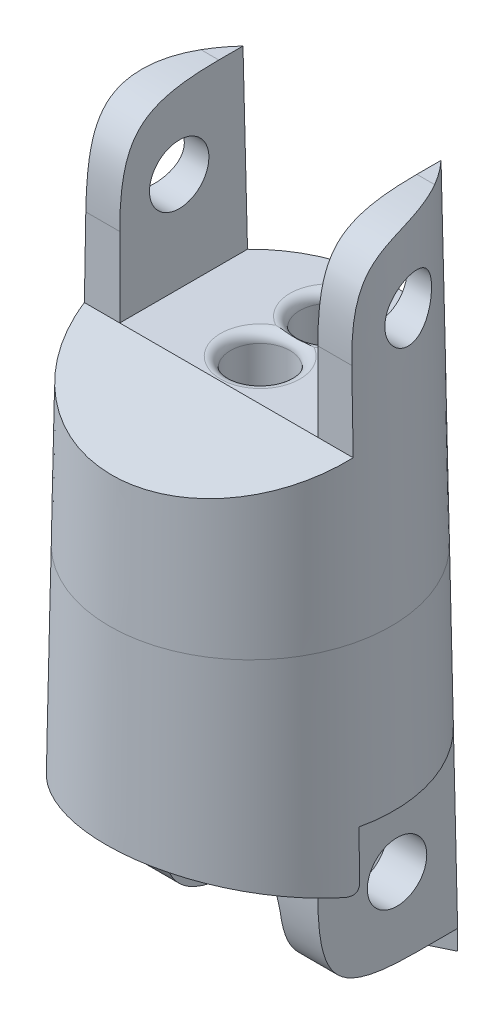
from build123d import *

# Parameters (mm, degrees)
SKETCH1_R                     = 7.25
BOSS_EXTRUDE1_DEPTH           = 25
BOSS_EXTRUDE1_TAPER           = 1.0000000000000022
BOSS_EXTRUDE1_OTHER_WAY_DEPTH = 9
BOSS_EXTRUDE1_OTHER_WAY_TAPER = -1.0000000000000022
CUT_EXTRUDE1_DEPTH            = 28.105905813890665
CUT_EXTRUDE1_DEPTH_BACK       = 28.105905813890665
CUT_EXTRUDE2_START            = -9.0000001
CUT_EXTRUDE2_OUTLINE_W        = 6.011422006
CUT_EXTRUDE2_OUTLINE_H        = 9
CUT_EXTRUDE2_DEPTH            = 9.0000001
CUT_EXTRUDE3_DEPTH            = 29.808463581509777
CUT_EXTRUDE3_DEPTH_BACK       = 29.808463581509777
SKETCH4_R                     = 1.5000000000000007
FILLET1_SIZE                  = 5
CUT_EXTRUDE4_DEPTH            = 28.063399138452198
CUT_EXTRUDE4_DEPTH_BACK       = 28.063399138452198
CUT_EXTRUDE5_DEPTH            = 28.542013511179608
CUT_EXTRUDE6_DEPTH            = 29.808463581509773
CUT_EXTRUDE6_DEPTH_BACK       = 29.808463581509773
SKETCH7_R                     = 1.5000000000000004
FILLET2_SIZE                  = 5
CUT_EXTRUDE7_DEPTH            = 9
BOSS_EXTRUDE2_START           = 1
BOSS_EXTRUDE2_DEPTH           = 1
SKETCH11_R                    = 1.5000000000000004
SKETCH11_R_2                  = 1.5000000000000002
CUT_EXTRUDE8_DEPTH            = 16
FILLET4_R                     = 0.5


with BuildPart() as part:
    # Sketch1 → Boss-Extrude1 (new body)
    with BuildSketch(Plane(origin=(0, 0, 0), x_dir=(1, 0, 0), z_dir=(0, 1, 0))):
        Circle(SKETCH1_R)
    extrude(amount=BOSS_EXTRUDE1_DEPTH, taper=BOSS_EXTRUDE1_TAPER)

    # Sketch1 → Boss-Extrude1 other way (add)
    with BuildSketch(Plane(origin=(0, 0, 0), x_dir=(1, 0, 0), z_dir=(0, 1, 0))):
        Circle(SKETCH1_R)
    extrude(amount=-BOSS_EXTRUDE1_OTHER_WAY_DEPTH, taper=BOSS_EXTRUDE1_OTHER_WAY_TAPER)

    # Sketch2 → Cut-Extrude1 (cut, two sides: drawn at the far end of the back side and taken through both)
    with BuildSketch(Plane(origin=(0, 0, 0), x_dir=(0, 0, -1), z_dir=(1, 0, 0)).offset(-CUT_EXTRUDE1_DEPTH_BACK)):
        Polygon((-1.5929044156460401, -9), (-1.5929044156460401, -2.999999999999999), (-14.33710947936327, 0.41479945499961435), (-14.337109479363269, -9), align=None)
    extrude(amount=CUT_EXTRUDE1_DEPTH + CUT_EXTRUDE1_DEPTH_BACK, mode=Mode.SUBTRACT)

    # Cut-Extrude2: read off the stored shape, not the designer's step
    # Cut-Extrude2 outline → Cut-Extrude2 (cut)
    with BuildSketch(Plane.XY.offset(1.5929044156460401).offset(CUT_EXTRUDE2_START)):
        with Locations((8.005711003, -4.5)):
            Rectangle(CUT_EXTRUDE2_OUTLINE_W, CUT_EXTRUDE2_OUTLINE_H)
        with Locations((-8.005711003, -4.5)):
            Rectangle(CUT_EXTRUDE2_OUTLINE_W, CUT_EXTRUDE2_OUTLINE_H)
    extrude(amount=CUT_EXTRUDE2_DEPTH, mode=Mode.SUBTRACT)

    # Sketch4 → Cut-Extrude3 (cut, two sides: drawn at the far end of the back side and taken through both)
    with BuildSketch(Plane(origin=(5.000000000000001, 4.8e-16, 0), x_dir=(0, 0, -1), z_dir=(1, 1e-16, 0)).offset(-CUT_EXTRUDE3_DEPTH_BACK)):
        with Locations(Location((2.40709558435396, -4.999999999999999, 0), (0, 0, 270))):
            Circle(SKETCH4_R)
    extrude(amount=CUT_EXTRUDE3_DEPTH + CUT_EXTRUDE3_DEPTH_BACK, mode=Mode.SUBTRACT)

    # Fillet1
    # a fillet whose section is not a circle: 5 mm, written as the material it takes off along each edge
    with BuildSketch(Plane(origin=(17.5, -9, 1.5929044156460401), x_dir=(0, 0, -1), z_dir=(-1, 0, 0))) as fillet1_piece_1:
        with BuildLine():
            Bezier((FILLET1_SIZE, 0), (0, 0), (0, -FILLET1_SIZE), weights=[1, 1.4999999999999998, 1])
            Line((0, -FILLET1_SIZE), (0, 0))
            Line((0, 0), (FILLET1_SIZE, 0))
        make_face()
    extrude(amount=35, mode=Mode.SUBTRACT)

    # Sketch5 → Cut-Extrude4 (cut, two sides: drawn at the far end of the back side and taken through both)
    with BuildSketch(Plane(origin=(0, 0, 0), x_dir=(0, 0, -1), z_dir=(1, 0, 0)).offset(-CUT_EXTRUDE4_DEPTH_BACK)):
        Polygon((-1.5929044156460401, 25), (-1.592904415646039, 16), (-13.213514486890537, 12.886266915853101), (-13.213514486890539, 25), align=None)
    extrude(amount=CUT_EXTRUDE4_DEPTH + CUT_EXTRUDE4_DEPTH_BACK, mode=Mode.SUBTRACT)

    # Sketch6 → Cut-Extrude5 (cut, through all)
    with BuildSketch(Plane.XY.offset(1.5929044156460372)):
        Polygon((4.999999999999998, 25), (-5.000000000000002, 25), (-4.999999999999999, 16), (4.999999999999999, 16), align=None)
    extrude(amount=-CUT_EXTRUDE5_DEPTH, mode=Mode.SUBTRACT)

    # Sketch7 → Cut-Extrude6 (cut, two sides: drawn at the far end of the back side and taken through both)
    with BuildSketch(Plane(origin=(-4.999999999999995, -1.45e-15, 0), x_dir=(0, 0, -1), z_dir=(1, 2.9e-16, 0)).offset(-CUT_EXTRUDE6_DEPTH_BACK)):
        with Locations(Location((1.407095584353963, 21, 0), (0, 0, 90))):
            Circle(SKETCH7_R)
    extrude(amount=CUT_EXTRUDE6_DEPTH + CUT_EXTRUDE6_DEPTH_BACK, mode=Mode.SUBTRACT)

    # Fillet2
    # a fillet whose section is not a circle: 5 mm, written as the material it takes off along each edge
    with BuildSketch(Plane(origin=(-7.5, 25, 1.5929044156460401), x_dir=(0, -1, -1.3e-16), z_dir=(1, 0, 0))) as fillet2_piece_1:
        with BuildLine():
            Bezier((FILLET2_SIZE, 0), (0, 0), (6.7e-16, FILLET2_SIZE), weights=[1, 1.4999999999999998, 1])
            Line((6.7e-16, FILLET2_SIZE), (0, 0))
            Line((0, 0), (FILLET2_SIZE, 0))
        make_face()
    extrude(amount=26.62481086850157, mode=Mode.SUBTRACT)
    with BuildSketch(Plane(origin=(-19.124810868501584, 25, 1.5929044156460401), x_dir=(0, 0, -1), z_dir=(1, 0, 0))) as fillet2_piece_2:
        with BuildLine():
            Bezier((FILLET2_SIZE, 0), (8.9e-16, 0), (6.7e-16, -FILLET2_SIZE), weights=[1, 1.4999999999999998, 1])
            Line((6.7e-16, -FILLET2_SIZE), (0, 0))
            Line((0, 0), (FILLET2_SIZE, 0))
        make_face()
    extrude(amount=26.624810868501584, mode=Mode.SUBTRACT)

    # Fillet3
    # a fillet whose section is not a circle: 0.5 mm, written as the material it takes off along each edge
    with BuildSketch(Plane(origin=(-8.755545096423258, -2.999999999999999, 1.5929044156460401), x_dir=(0, 0.2588190451025175, 0.9659258262890692), z_dir=(1, 0, 0))) as fillet3_piece_1:
        with BuildLine():
            Bezier((0.6516126864206009, 0), (0, 0), (0.16864977327606598, -0.6294095225512586), weights=[1, 1, 1])
            Line((0.16864977327606598, -0.6294095225512586), (0, 0))
            Line((0, 0), (0.6516126864206009, 0))
        make_face()
    extrude(amount=3.7555450964232584, mode=Mode.SUBTRACT)
    with BuildSketch(Plane(origin=(5, -2.999999999999999, 1.5929044156460401), x_dir=(0, 1, 0), z_dir=(1, 0, 0))) as fillet3_piece_2:
        with BuildLine():
            Bezier((0.6516126864206004, 0), (0, 0), (0.16864977327606612, 0.629409522551259), weights=[1, 1, 1])
            Line((0.16864977327606612, 0.629409522551259), (0, 0))
            Line((0, 0), (0.6516126864206004, 0))
        make_face()
    extrude(amount=3.7555450964232335, mode=Mode.SUBTRACT)

    # Sketch9 → Cut-Extrude7 (cut)
    with BuildSketch(Plane.XZ.offset(9)):
        with BuildLine():
            Line((-2.999999999999999, -4.498520052010449), (-2.999999999999999, 1.4985200520104496))
            ThreePointArc((-2.999999999999999, 1.4985200520104496), (3.3e-16, 2.40709558435396), (3.000000000000001, 1.4985200520104478))
            Line((3.000000000000001, 1.4985200520104478), (3.000000000000001, -4.4985200520104485))
            ThreePointArc((3.000000000000001, -4.4985200520104485), (3.3e-16, -5.40709558435396), (-2.999999999999999, -4.498520052010449))
        make_face()
    extrude(amount=-CUT_EXTRUDE7_DEPTH, mode=Mode.SUBTRACT)

    # Sketch10 → Boss-Extrude2 (add)
    with BuildSketch(Plane.XZ.offset(9).offset(BOSS_EXTRUDE2_START)):
        with BuildLine():
            Line((-2.999999999999999, -4.498520052010449), (-5, -5.464893868663502))
            ThreePointArc((-5, -5.464893868663502), (4.5e-16, -7.407095584353961), (5.000000000000001, -5.4648938686635))
            Line((5.000000000000001, -5.4648938686635), (2.999999999999999, -4.498520052010449))
            ThreePointArc((2.999999999999999, -4.498520052010449), (3.3e-16, -5.40709558435396), (-2.999999999999999, -4.498520052010449))
        make_face()
    extrude(amount=-BOSS_EXTRUDE2_DEPTH)

    # Sketch11 → Cut-Extrude8 (cut)
    with BuildSketch(Plane(origin=(0, 16, 0), x_dir=(1, 0, 0), z_dir=(0, 1, 0))):
        with Locations(Location((0, 4, 0), (0, 0, 270))):
            Circle(SKETCH11_R)
        with Locations(Location((0, 0.5, 0), (0, 0, 270))):
            Circle(SKETCH11_R_2)
    extrude(amount=-CUT_EXTRUDE8_DEPTH, mode=Mode.SUBTRACT)

    # Fillet4
    # the kernel refuses this fillet: 0.5 mm, written as the material it takes off along each edge
    with BuildSketch(Plane(origin=(0, 16, -4), x_dir=(-1.8e-16, 0, 1), z_dir=(-1, 0, -1.8e-16))) as fillet4_piece_1:
        with BuildLine():
            CenterArc((1.5 + FILLET4_R, -FILLET4_R), FILLET4_R, 90, 90)
            Line((1.5, -FILLET4_R), (1.5, 0))
            Line((1.5, 0), (1.5 + FILLET4_R, 0))
        make_face()
    revolve(axis=Axis((0, 16, -4), (0, 1, 0)), mode=Mode.SUBTRACT)
    with BuildSketch(Plane(origin=(0, 0, -4), x_dir=(-1.8e-16, 0, 1), z_dir=(-1, 0, -1.8e-16))) as fillet4_piece_2_section:
        with BuildLine():
            CenterArc((1.5000000000000009 + FILLET4_R, FILLET4_R), FILLET4_R, 180, 90)
            Line((1.5000000000000009 + FILLET4_R, 0), (1.5000000000000009, 0))
            Line((1.5000000000000009, 0), (1.5000000000000009, FILLET4_R))
        make_face()
    fillet4_piece_2 = revolve(axis=Axis((0, 0, -4), (0, 1, 0)), revolution_arc=204.08928885660288, mode=Mode.PRIVATE)
    fillet4_piece_2 = fillet4_piece_2 & Plane(origin=(0, 0, 3.55e-15), x_dir=(0.554826515122247, 0, -0.83196606788817), z_dir=(0, -1, 0)) * Cylinder(5.407095584353963, 9, mode=Mode.PRIVATE)
    add(fillet4_piece_2, mode=Mode.SUBTRACT)
    with BuildSketch(Plane(origin=(0, 16, -0.5), x_dir=(-1.8e-16, 0, 1), z_dir=(-1, 0, -1.8e-16))) as fillet4_piece_3:
        with BuildLine():
            CenterArc((1.5 + FILLET4_R, -FILLET4_R), FILLET4_R, 90, 90)
            Line((1.5, -FILLET4_R), (1.5, 0))
            Line((1.5, 0), (1.5 + FILLET4_R, 0))
        make_face()
    revolve(axis=Axis((0, 16, -0.5), (0, 1, 0)), mode=Mode.SUBTRACT)
    with BuildSketch(Plane(origin=(0, 0, -0.5), x_dir=(-1.8e-16, 0, 1), z_dir=(-1, 0, -1.8e-16))) as fillet4_piece_4:
        with BuildLine():
            CenterArc((1.5 + FILLET4_R, FILLET4_R), FILLET4_R, 180, 90)
            Line((1.5 + FILLET4_R, 0), (1.5, 0))
            Line((1.5, 0), (1.5, FILLET4_R))
        make_face()
    revolve(axis=Axis((0, 0, -0.5), (0, 1, 0)), mode=Mode.SUBTRACT)
    with BuildSketch(Plane(origin=(0, 0, -4), x_dir=(0.4081598037184505, 0, -0.9129104965047318), z_dir=(0.9129104965047318, 0, 0.4081598037184505))) as fillet4_piece_5_section:
        with BuildLine():
            CenterArc((1.5000000000000002 + FILLET4_R, FILLET4_R), FILLET4_R, 180, 90)
            Line((1.5000000000000002 + FILLET4_R, 0), (1.5000000000000002, 0))
            Line((1.5000000000000002, 0), (1.5000000000000002, FILLET4_R))
        make_face()
    fillet4_piece_5 = revolve(axis=Axis((0, 0, -4), (0, 1, 0)), revolution_arc=204.08928885660288, mode=Mode.PRIVATE)
    fillet4_piece_5 = fillet4_piece_5 & Plane(origin=(0, 0, 3.55e-15), x_dir=(0.554826515122247, 0, -0.83196606788817), z_dir=(0, -1, 0)) * Cylinder(5.407095584353963, 9, mode=Mode.PRIVATE)
    add(fillet4_piece_5, mode=Mode.SUBTRACT)


with BuildPart() as body_2:
    # Split1: the piece on the far side of the plane
    add(part.part)
    split(bisect_by=Plane.ZX.offset(8), keep=Keep.BOTTOM)


with BuildPart() as part_1:
    add(part.part)

    # Split1
    split(bisect_by=Plane.ZX.offset(8), keep=Keep.TOP)


solid = Compound([body_2.part, part_1.part])
